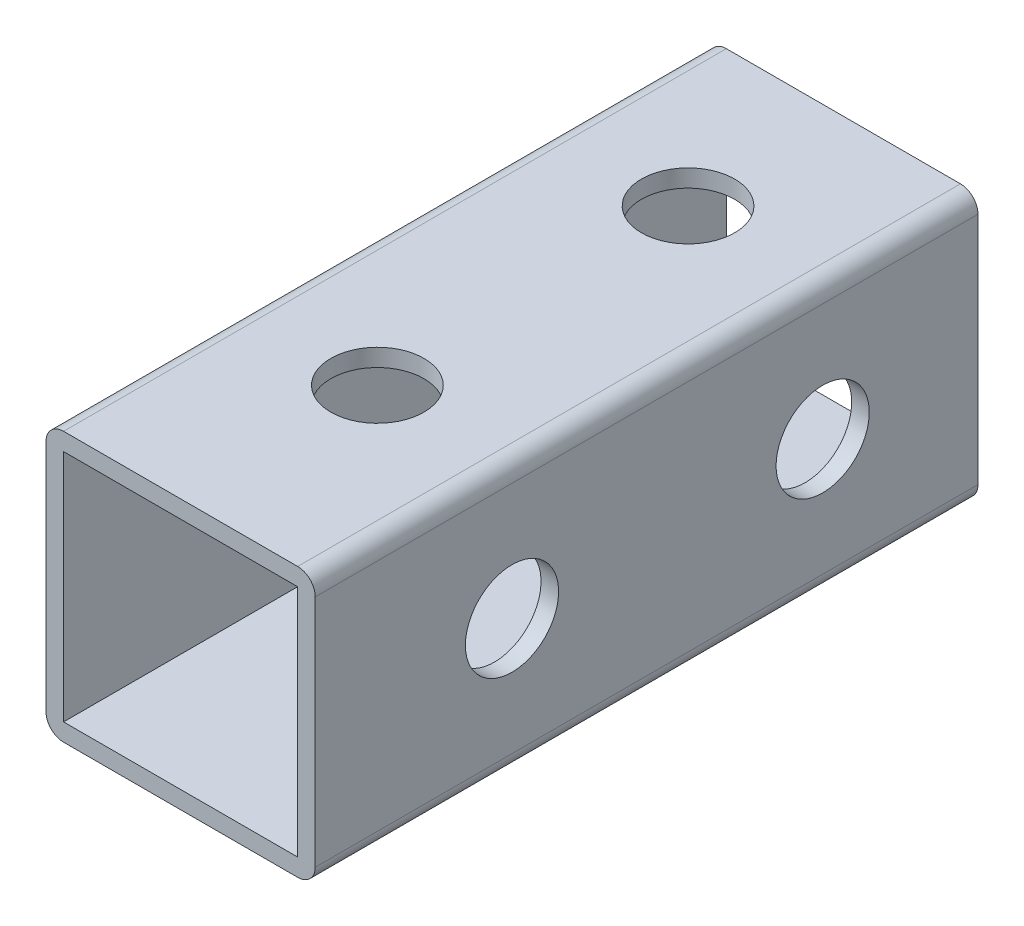
from build123d import *

# Parameters (mm, degrees)
SKETCH1_W                 = 35.8902
SKETCH1_H                 = 35.8902
BASE_EXTRUDE_DEPTH        = 101.6
HOLE1_START               = -20.6375
HOLE1_OUTLINE_R           = 7.14375
HOLE1_DEPTH               = 41.275
CIRPATTERN2_COUNT         = 2
CIRPATTERN2_ANGLE         = 90
LPATTERN1_COUNT           = 2
LPATTERN1_PITCH           = 47.625
LPATTERN1_START           = -20.6375
LPATTERN1_COPY_1_SKETCH_R = 7.14375
LPATTERN1_COPY_1_DEPTH    = 41.275


# Read off the part's stored shape, not the designer's step: Hole1
with BuildPart() as part:
    # Sketch1 → Base-Extrude (new body)
    with BuildSketch(Plane.XY):
        with BuildLine():
            Line((-20.6375, 17.9451), (-20.6375, -17.9451))
            ThreePointArc((-20.6375, -17.9451), (-19.848914298, -19.848914298), (-17.9451, -20.6375))
            Line((-17.9451, -20.6375), (17.9451, -20.6375))
            ThreePointArc((17.9451, -20.6375), (19.848914298, -19.848914298), (20.6375, -17.9451))
            Line((20.6375, -17.9451), (20.6375, 17.9451))
            ThreePointArc((20.6375, 17.9451), (19.848914298, 19.848914298), (17.9451, 20.6375))
            Line((17.9451, 20.6375), (-17.9451, 20.6375))
            ThreePointArc((-17.9451, 20.6375), (-19.848914298, 19.848914298), (-20.6375, 17.9451))
        make_face()
        Rectangle(SKETCH1_W, SKETCH1_H, mode=Mode.SUBTRACT)
    extrude(amount=BASE_EXTRUDE_DEPTH)

    # Hole1 outline → Hole1 (cut)
    with BuildSketch(Plane(origin=(0, 0, 0), x_dir=(1, 0, 0), z_dir=(0, 1, 0)).offset(HOLE1_START)):
        with Locations((0, -23.8125)):
            Circle(HOLE1_OUTLINE_R)
    hole1 = extrude(amount=HOLE1_DEPTH, mode=Mode.SUBTRACT)

    # CirPattern2: Hole1 ×2 about axis
    cirpattern2_axis = Axis((0, 0, -50), (0, 0, 1))
    for i in range(1, CIRPATTERN2_COUNT):
        add(hole1.rotate(cirpattern2_axis, i * CIRPATTERN2_ANGLE / (CIRPATTERN2_COUNT - 1)), mode=Mode.SUBTRACT)

    # LPattern1: Hole1 ×2
    with Locations(*[(0, 0, i * LPATTERN1_PITCH) for i in range(1, LPATTERN1_COUNT)]):
        add(hole1, mode=Mode.SUBTRACT)

    # LPattern1 copy 1 sketch → LPattern1 copy 1 (cut)
    with BuildSketch(Plane(origin=(0, 0, 47.625), x_dir=(0, 1, 0), z_dir=(-1, 0, 0)).offset(LPATTERN1_START)):
        with Locations((0, -23.8125)):
            Circle(LPATTERN1_COPY_1_SKETCH_R)
    extrude(amount=LPATTERN1_COPY_1_DEPTH, mode=Mode.SUBTRACT)


solid = part.part
